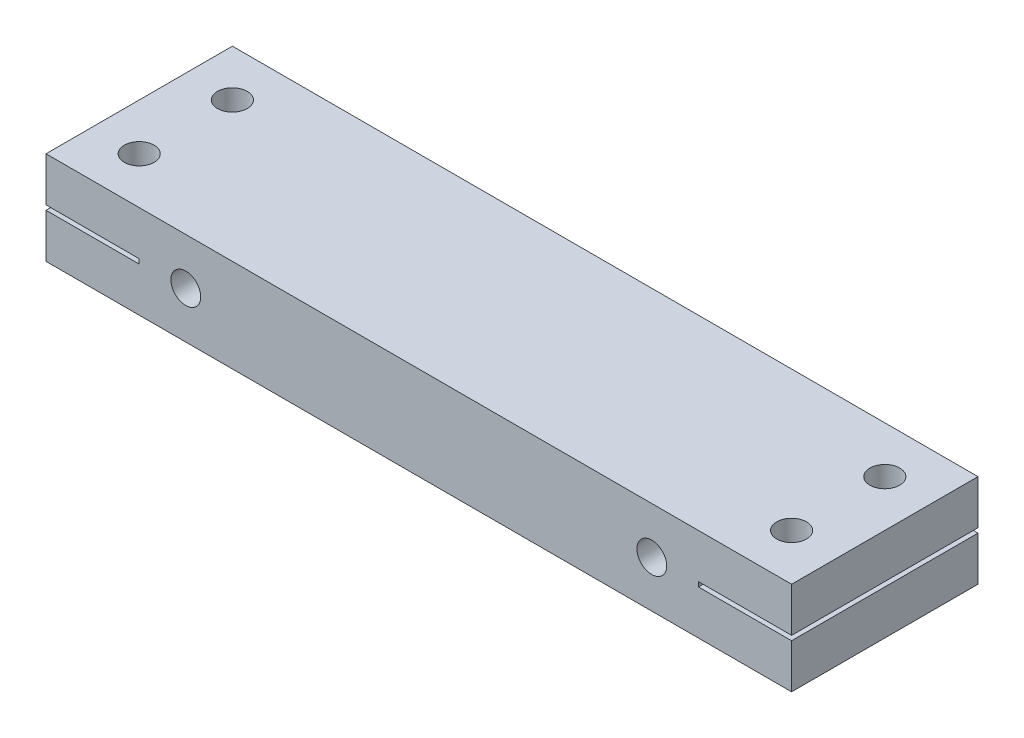
from build123d import *

# Parameters (mm, degrees)
SKETCH1_W           = 80
SKETCH1_H           = 10
BOSS_EXTRUDE1_DEPTH = 10
SKETCH2_W           = 10
SKETCH2_H           = 0.5
CUT_EXTRUDE1_DEPTH  = 83.613558209
SKETCH3_R           = 1.6
CUT_EXTRUDE2_DEPTH  = 82.240384046
SKETCH5_R           = 1.6
CUT_EXTRUDE3_DEPTH  = 83.613558209


with BuildPart() as part:
    # Sketch1 → Boss-Extrude1 (new, symmetric)
    with BuildSketch(Plane.XY):
        with Locations((40, 0)):
            Rectangle(SKETCH1_W, SKETCH1_H)
    extrude(amount=BOSS_EXTRUDE1_DEPTH, both=True)

    # Sketch2 → Cut-Extrude1 (cut, through all)
    with BuildSketch(Plane.XY.offset(10)):
        with Locations((5, 0)):
            Rectangle(SKETCH2_W, SKETCH2_H)
        with Locations((75, 0)):
            Rectangle(SKETCH2_W, SKETCH2_H)
    extrude(amount=-CUT_EXTRUDE1_DEPTH, mode=Mode.SUBTRACT)

    # Sketch3 → Cut-Extrude2 (cut, through all)
    with BuildSketch(Plane(origin=(0, 5, 0), x_dir=(1, 0, 0), z_dir=(0, 1, 0))):
        with Locations((5, 5)):
            Circle(SKETCH3_R)
        with Locations((75, 5)):
            Circle(SKETCH3_R)
        with Locations((5, -5)):
            Circle(SKETCH3_R)
        with Locations((75, -5)):
            Circle(SKETCH3_R)
    extrude(amount=-CUT_EXTRUDE2_DEPTH, mode=Mode.SUBTRACT)

    # Sketch5 → Cut-Extrude3 (cut, through all)
    with BuildSketch(Plane.XY.offset(10)):
        with Locations((15, 0)):
            Circle(SKETCH5_R)
        with Locations((65, 0)):
            Circle(SKETCH5_R)
    extrude(amount=-CUT_EXTRUDE3_DEPTH, mode=Mode.SUBTRACT)


solid = part.part
